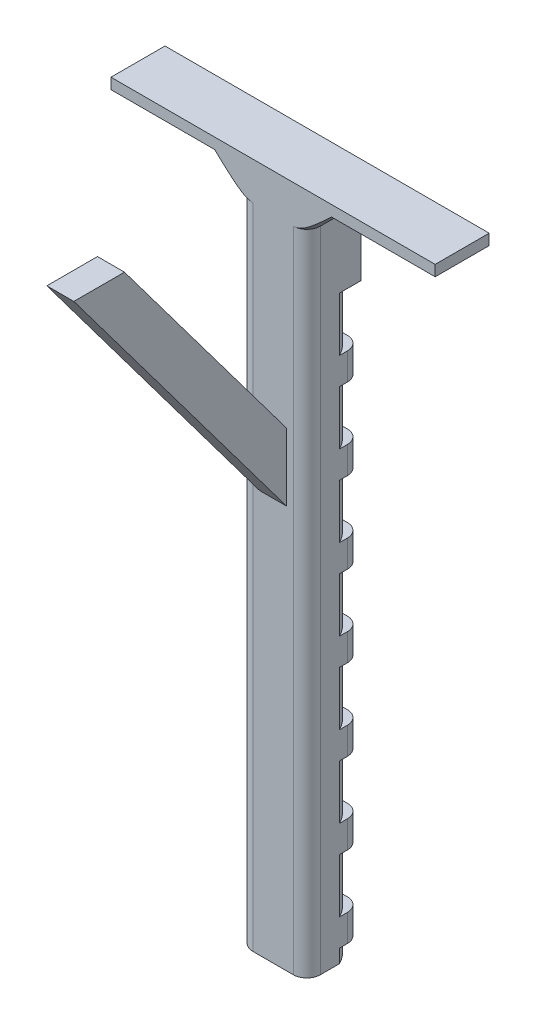
from build123d import *

# Parameters (mm, degrees)
SKETCH1_W                = 25
SKETCH1_H                = 250
BOSS_EXTRUDE1_DEPTH      = 20
SKETCH2_W                = 120
SKETCH2_H                = 4
BOSS_EXTRUDE2_DEPTH      = 20
CUT_EXTRUDE1_DEPTH       = 20
LPATTERN1_COUNT          = 5
LPATTERN1_PITCH          = 30
LPATTERN1_COUNT_DIR2     = 4
LPATTERN1_PITCH_DIR2     = 30
FILLET1_R                = 5
BOSS_EXTRUDE4_DEPTH      = 5
BOSS_EXTRUDE4_DEPTH_BACK = 5
FILLET2_R                = 5
CHAMFER1_SIZE            = 10


with BuildPart() as part:
    # Sketch1 → Boss-Extrude1 (new body)
    with BuildSketch(Plane.XY):
        Rectangle(SKETCH1_W, SKETCH1_H)
    extrude(amount=BOSS_EXTRUDE1_DEPTH)

    # Sketch2 → Boss-Extrude2 (add)
    with BuildSketch(Plane.XY):
        with Locations((0, 127)):
            Rectangle(SKETCH2_W, SKETCH2_H)
    extrude(amount=BOSS_EXTRUDE2_DEPTH)

    # Sketch5 → Cut-Extrude1 (cut)
    with BuildSketch(Plane(origin=(0, 0, 0), x_dir=(1, 0, 0), z_dir=(0, 1, 0))):
        with BuildLine():
            Line((1.199542867, -0.052363953), (1.199542867, 0))
            Line((1.199542867, 0), (12.5, 0))
            Line((12.5, 0), (12.5, -8))
            ThreePointArc((12.5, -8), (7.91900236, -2.505881075), (1.199542867, -0.052363953))
        make_face()
        with BuildLine():
            Line((-1.199542867, -0.052363953), (-1.199542867, 0))
            Line((-1.199542867, 0), (-12.5, 0))
            Line((-12.5, 0), (-12.5, -8))
            ThreePointArc((-12.5, -8), (-7.91900236, -2.505881075), (-1.199542867, -0.052363953))
        make_face()
    cut_extrude1 = extrude(amount=-CUT_EXTRUDE1_DEPTH, mode=Mode.SUBTRACT)

    # LPattern1: Cut-Extrude1 5 × 4
    with Locations(*[Vector(0, -1, 0) * (i * LPATTERN1_PITCH) + Vector(0, 1, 0) * (j * LPATTERN1_PITCH_DIR2) for i in range(LPATTERN1_COUNT) for j in range(LPATTERN1_COUNT_DIR2) if (i, j) != (0, 0)]):
        add(cut_extrude1, mode=Mode.SUBTRACT)

    # Fillet1
    fillet1_edges = [part.edges().sort_by_distance(p)[0] for p in [
        (-12.5, 65, 0),
        (12.5, 65, 0),
        (12.5, 35, 0),
        (12.5, 5, 0),
        (12.5, -25, 0),
        (12.5, -55, 0),
        (12.5, -85, 0),
        (12.5, -115, 0),
        (-12.5, 35, 0),
        (-12.5, 5, 0),
        (-12.5, -25, 0),
        (-12.5, -55, 0),
        (-12.5, -85, 0),
        (-12.5, -115, 0),
    ]]
    fillet(fillet1_edges, radius=FILLET1_R)

    # Sketch6 → Boss-Extrude4 (add, two sides: drawn at the far end of the back side and taken through both)
    with BuildSketch(Plane(origin=(0, 0, 0), x_dir=(0, 0, -1), z_dir=(1, 0, 0)).offset(-BOSS_EXTRUDE4_DEPTH_BACK)):
        Polygon((-20, 49), (-80, 129), (-98.75, 129), (-20, 24), align=None)
    extrude(amount=BOSS_EXTRUDE4_DEPTH + BOSS_EXTRUDE4_DEPTH_BACK)

    # Fillet2
    fillet2_edges = [part.edges().sort_by_distance(p)[0] for p in [
        (12.5, 0, 20),
        (-12.5, 0, 20),
    ]]
    fillet(fillet2_edges, radius=FILLET2_R)

    # Chamfer1
    chamfer1_edges = [part.edges().sort_by_distance(p)[0] for p in [
        (-12.5, 125, 7.5),
        (-11.035533906, 125, 18.535533906),
    ]]
    chamfer(chamfer1_edges, length=CHAMFER1_SIZE)
    chamfer1_2_edges = [part.edges().sort_by_distance(p)[0] for p in [
        (12.5, 125, 7.5),
        (11.035533906, 125, 18.535533906),
    ]]
    chamfer(chamfer1_2_edges, length=CHAMFER1_SIZE)


solid = part.part
